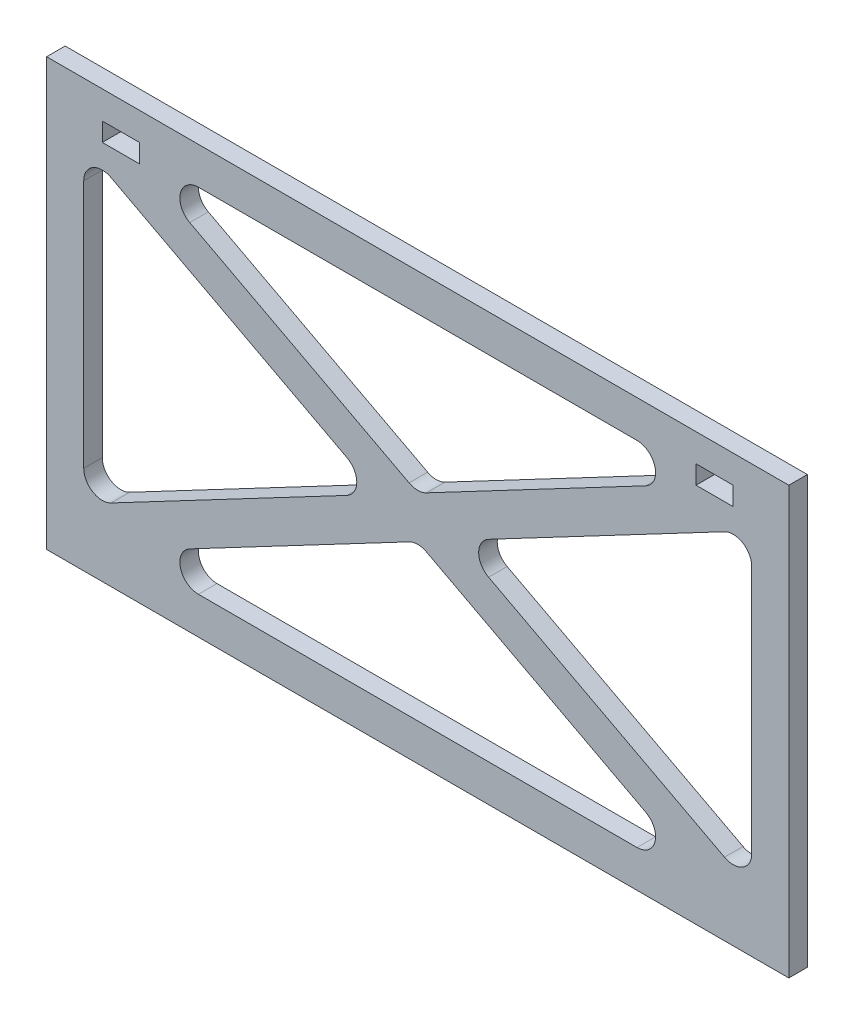
from build123d import *

# Parameters (mm, degrees)
SKETCH1_W               = 203.2
SKETCH1_H               = 116.84
BOSS_EXTRUDE1_DEPTH     = 5.08
FILLET1_R               = 5.08
CUT_EXTRUDE1_DEPTH      = 118.308408906
CUT_EXTRUDE1_DEPTH_BACK = 118.308408906
SKETCH2_W               = 10.16
SKETCH2_H               = 5.08


with BuildPart() as part:
    # Sketch1 → Boss-Extrude1 (new body)
    with BuildSketch(Plane.XY):
        Rectangle(SKETCH1_W, SKETCH1_H)
        Polygon((10.883569766, 0), (91.44, 42.515893734), (91.44, -42.515893734), align=None, mode=Mode.SUBTRACT)
        Polygon((80.556430234, 48.26), (0, 5.744106266), (-80.556430234, 48.26), align=None, mode=Mode.SUBTRACT)
        Polygon((-91.44, -42.515893734), (-91.44, 42.515893734), (-10.883569766, 0), align=None, mode=Mode.SUBTRACT)
        Polygon((80.556430234, -48.26), (-80.556430234, -48.26), (0, -5.744106266), align=None, mode=Mode.SUBTRACT)
    extrude(amount=BOSS_EXTRUDE1_DEPTH)

    # Fillet1
    fillet1_edges = [part.edges().sort_by_distance(p)[0] for p in [
        (10.883569766, 0, 2.54),
        (91.44, -42.515893734, 2.54),
        (80.556430234, -48.26, 2.54),
        (-80.556430234, -48.26, 2.54),
        (91.44, 42.515893734, 2.54),
        (80.556430234, 48.26, 2.54),
        (-80.556430234, 48.26, 2.54),
        (0, -5.744106266, 2.54),
        (-10.883569766, 0, 2.54),
        (0, 5.744106266, 2.54),
        (-91.44, -42.515893734, 2.54),
        (-91.44, 42.515893734, 2.54),
    ]]
    fillet(fillet1_edges, radius=FILLET1_R)

    # Sketch2 → Cut-Extrude1 (cut, two sides: drawn at the far end of the back side and taken through both)
    with BuildSketch(Plane.XY.offset(5.08).offset(-CUT_EXTRUDE1_DEPTH_BACK)):
        with Locations((-81.28, 48.26)):
            Rectangle(SKETCH2_W, SKETCH2_H)
        with Locations((81.28, 48.26)):
            Rectangle(SKETCH2_W, SKETCH2_H)
    extrude(amount=CUT_EXTRUDE1_DEPTH + CUT_EXTRUDE1_DEPTH_BACK, mode=Mode.SUBTRACT)


solid = part.part
